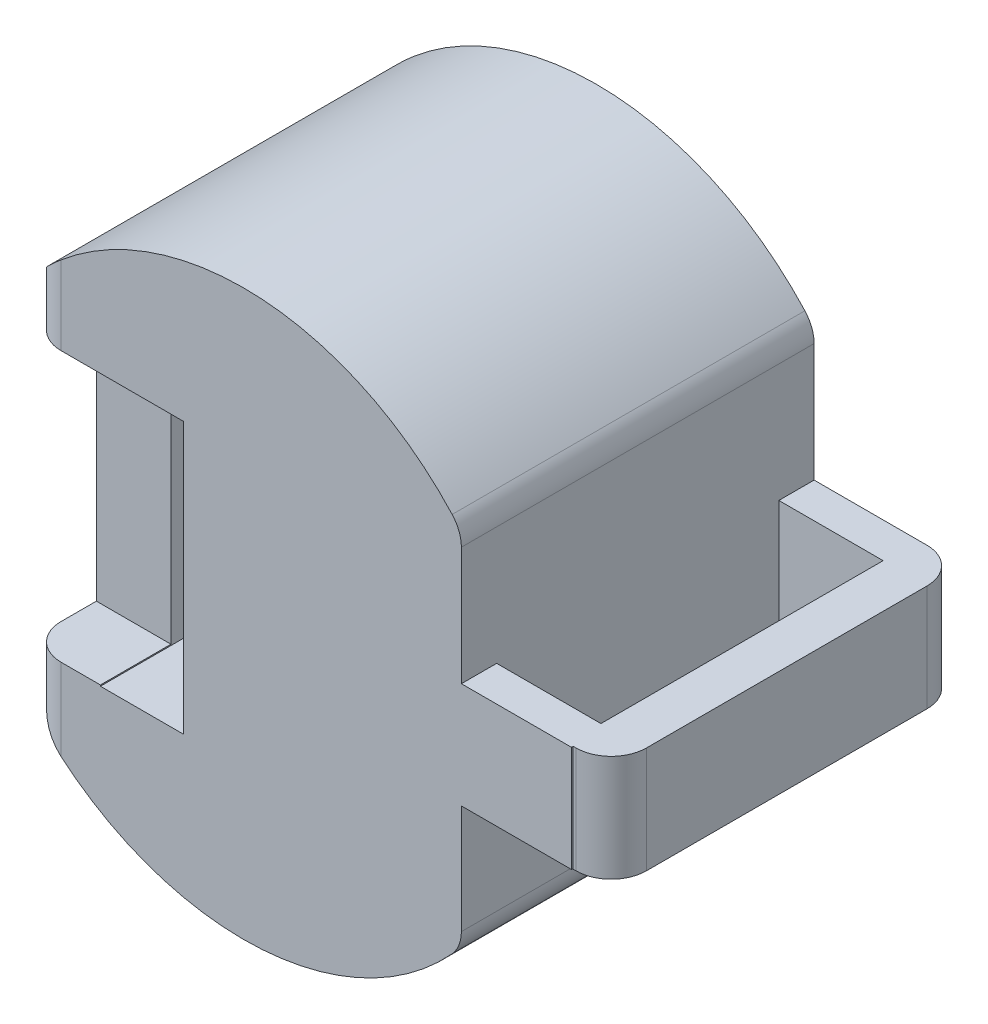
from build123d import *

# Parameters (mm, degrees)
SKETCH_1_R            = 8
EXTRUDE_1_DEPTH       = 10
SKETCH_9_W            = 7.120641766
SKETCH_9_H            = 4.534999238
EXTRUDE_6_DEPTH       = 1
SKETCH_11_W           = 1.257653538
SKETCH_11_H           = 9
EXTRUDE_7_DEPTH       = 4.5
EXTRUDE_8_DEPTH       = 6
FILLET_8_R            = 1
FILLET_9_R            = 1
CUT_EXTRUDE_1_DEPTH   = 10
SKETCH_14_W           = 1
SKETCH_14_H           = 3
EXTRUDE_9_DEPTH       = 3.122043073
SKETCH_15_W           = 1
SKETCH_15_H           = 3
EXTRUDE_10_DEPTH      = 4
EXTRUDE_11_DEPTH      = 0.2
EXTRUDE_11_DEPTH_BACK = 1.043632387
SKETCH_16_W           = 9.952294967
SKETCH_16_H           = 3.01746433
FILLET_11_R           = 1
FILLET_12_R           = 1
FILLET_13_R           = 1
FILLET_14_R           = 1
CUT_EXTRUDE_2_DEPTH   = 10
SKETCH_18_W           = 2.361428176
SKETCH_18_H           = 7.68123899
CUT_EXTRUDE_3_DEPTH   = 10
SKETCH_19_W           = 2.115065294
SKETCH_19_H           = 7.68123899
CUT_EXTRUDE_4_DEPTH   = 2
SKETCH_20_W           = 2.115065294
SKETCH_20_H           = 7.649055087
CUT_EXTRUDE_5_DEPTH   = 2
FILLET_15_R           = 1
FILLET_16_R           = 1
FILLET_17_R           = 1
FILLET_18_R           = 1


with BuildPart() as part:
    # 草圖1 → 填料-伸長1 (new body)
    with BuildSketch(Plane(origin=(0.382706605, 0, 0), x_dir=(1, 0, 0), z_dir=(0, 0, 1))):
        with Locations((-75.594417438, 2.55)):
            Circle(SKETCH_1_R)
    extrude(amount=EXTRUDE_1_DEPTH)

    # 草圖9 → 填料-伸長6 (add)
    with BuildSketch(Plane(origin=(6.127831546, 0, 9), x_dir=(1, 0, 0), z_dir=(0, 0, 1))):
        with Locations((-75.644850643, 2.267499619)):
            Rectangle(SKETCH_9_W, SKETCH_9_H)
    extrude(amount=EXTRUDE_6_DEPTH)



with BuildPart() as body_2:
    # 草圖11 → 填料-伸長7 (new body)
    with BuildSketch(Plane(origin=(9.574526933, 4.534999238, 0.48426017), x_dir=(1, 0, 0), z_dir=(0, 1, 0))):
        with Locations((-76.184774061, -4.5)):
            Rectangle(SKETCH_11_W, SKETCH_11_H)
    extrude(amount=-EXTRUDE_7_DEPTH)


with BuildPart() as part_1:
    add(part.part)

    add(body_2.part)  # 填料-伸長8 merges body 2
    # 草圖12 → 填料-伸長8 (add)
    with BuildSketch(Plane.ZY.offset(67.239073897)):
        Polygon((0.48426017, 4.534999238), (0.48426017, 0), (1.483647509, 0.034999238), (1.483647509, 4.534999238), align=None)
    extrude(amount=EXTRUDE_8_DEPTH)

    # 圓角8
    fillet_8_edges = [part_1.edges().sort_by_distance(p)[0] for p in [
        (-65.981420359, 2.284999238, 0.48426017),
    ]]
    fillet(fillet_8_edges, radius=FILLET_8_R)

    # 圓角9
    fillet_9_edges = [part_1.edges().sort_by_distance(p)[0] for p in [
        (-65.956698214, 2.267499619, 10),
    ]]
    fillet(fillet_9_edges, radius=FILLET_9_R - 0.0001)  # a hair under: the kernel refuses the full size

    # 草圖13 → 除料-伸長1 (cut)
    with BuildSketch(Plane(origin=(0, 0, 0), x_dir=(-1, 0, 0), z_dir=(0, 0, -1))):
        with BuildLine():
            Line((69.041558468, 7.642074214), (69.041558468, -2.542074214))
            ThreePointArc((69.041558468, -2.542074214), (63.949484255, 2.55), (69.041558468, 7.642074214))
        make_face()
    extrude(amount=-CUT_EXTRUDE_1_DEPTH, mode=Mode.SUBTRACT)

    # 草圖14 → 填料-伸長9 (add)
    with BuildSketch(Plane(origin=(-69.041558468, 0, 0), x_dir=(0, 0, -1), z_dir=(1, 0, 0))):
        with Locations((-9.5, 2.417510407)):
            Rectangle(SKETCH_14_W, SKETCH_14_H)
    extrude(amount=EXTRUDE_9_DEPTH)

    # 草圖15 → 填料-伸長10 (add)
    with BuildSketch(Plane(origin=(-69.041558468, 0, 0), x_dir=(0, 0, -1), z_dir=(1, 0, 0))):
        with Locations((-0.5, 2.417510407)):
            Rectangle(SKETCH_15_W, SKETCH_15_H)
    extrude(amount=EXTRUDE_10_DEPTH)

    # 草圖16 → 填料-伸長11 (add, two sides: drawn at the far end of the back side and taken through both)
    with BuildSketch(Plane(origin=(-65.041558468, 0, 0), x_dir=(0, 0, -1), z_dir=(1, 0, 0)).offset(-EXTRUDE_11_DEPTH_BACK)):
        with Locations((-4.976147484, 2.408778242)):
            Rectangle(SKETCH_16_W, SKETCH_16_H)
    extrude(amount=EXTRUDE_11_DEPTH + EXTRUDE_11_DEPTH_BACK)

    # 圓角11
    fillet_11_edges = [part_1.edges().sort_by_distance(p)[0] for p in [
        (-64.841558468, 2.408778242, 0),
    ]]
    fillet(fillet_11_edges, radius=FILLET_11_R)

    # 圓角12
    fillet_12_edges = [part_1.edges().sort_by_distance(p)[0] for p in [
        (-64.841558468, 2.408778242, 9.952294967),
    ]]
    fillet(fillet_12_edges, radius=FILLET_12_R)

    # 圓角13
    fillet_13_edges = [part_1.edges().sort_by_distance(p)[0] for p in [
        (-69.041558468, 7.642074214, 5),
    ]]
    fillet(fillet_13_edges, radius=FILLET_13_R)

    # 圓角14
    fillet_14_edges = [part_1.edges().sort_by_distance(p)[0] for p in [
        (-69.041558468, -2.542074214, 5),
    ]]
    fillet(fillet_14_edges, radius=FILLET_14_R)

    # 草圖17 → 除料-伸長2 (cut)
    with BuildSketch(Plane(origin=(0, 0, 0), x_dir=(-1, 0, 0), z_dir=(0, 0, -1))):
        with BuildLine():
            Line((81.390220844, 7.631930149), (81.390220844, -2.531930149))
            ThreePointArc((81.390220844, -2.531930149), (84.200552216, 2.55), (81.390220844, 7.631930149))
        make_face()
    extrude(amount=-CUT_EXTRUDE_2_DEPTH, mode=Mode.SUBTRACT)

    # 草圖18 → 除料-伸長3 (cut)
    with BuildSketch(Plane(origin=(0, 0, 0), x_dir=(-1, 0, 0), z_dir=(0, 0, -1))):
        with Locations((78.094441462, 2.579171883)):
            Rectangle(SKETCH_18_W, SKETCH_18_H)
    extrude(amount=-CUT_EXTRUDE_3_DEPTH, mode=Mode.SUBTRACT)

    # 草圖19 → 除料-伸長4 (cut)
    with BuildSketch(Plane(origin=(0, 0, 0), x_dir=(-1, 0, 0), z_dir=(0, 0, -1))):
        with Locations((80.332688197, 2.579171883)):
            Rectangle(SKETCH_19_W, SKETCH_19_H)
    extrude(amount=-CUT_EXTRUDE_4_DEPTH, mode=Mode.SUBTRACT)

    # 草圖20 → 除料-伸長5 (cut)
    with BuildSketch(Plane.XY.offset(10)):
        with Locations((-80.332688197, 2.595263834)):
            Rectangle(SKETCH_20_W, SKETCH_20_H)
    extrude(amount=-CUT_EXTRUDE_5_DEPTH, mode=Mode.SUBTRACT)

    # 圓角15
    fillet_15_edges = [part_1.edges().sort_by_distance(p)[0] for p in [
        (-81.390220844, 7.025860764, 0),
    ]]
    fillet(fillet_15_edges, radius=FILLET_15_R)

    # 圓角16
    fillet_16_edges = [part_1.edges().sort_by_distance(p)[0] for p in [
        (-81.390220844, 7.025860764, 10),
    ]]
    fillet(fillet_16_edges, radius=FILLET_16_R)

    # 圓角17
    fillet_17_edges = [part_1.edges().sort_by_distance(p)[0] for p in [
        (-81.390220844, -1.89668888, 0),
    ]]
    fillet(fillet_17_edges, radius=FILLET_17_R)

    # 圓角18
    fillet_18_edges = [part_1.edges().sort_by_distance(p)[0] for p in [
        (-81.390220844, -1.880596929, 10),
    ]]
    fillet(fillet_18_edges, radius=FILLET_18_R)


solid = part_1.part
